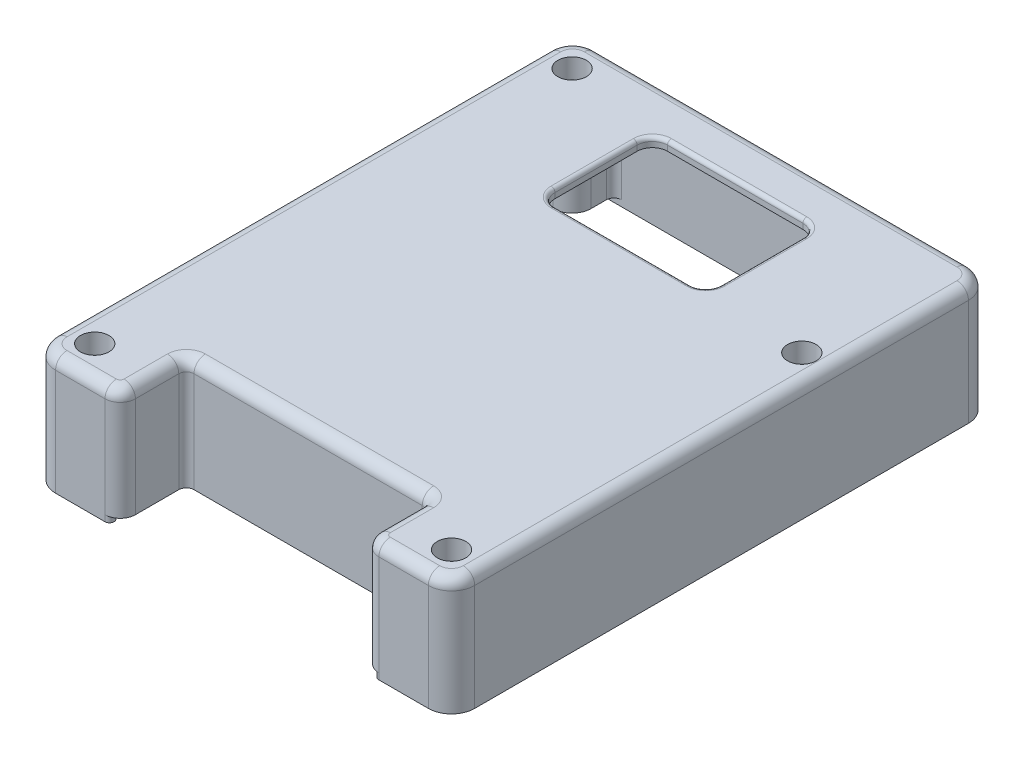
from build123d import *

# Parameters (mm, degrees)
ESQUISSE1_R             = 1.1
BOSS_EXTRU_1_DEPTH      = 13.5
BOSS_EXTRU_2_DEPTH      = 1.2
CONG_1_R                = 1.5
BOSS_EXTRU_3_START      = 0.8
BOSS_EXTRU_3_DEPTH      = 0.8
ESQUISSE4_W             = 37.676641801
ESQUISSE4_H             = 10.486455041
ENL_V_MAT_EXTRU_1_DEPTH = 0.8
CONG_2_R                = 0.6
ESQUISSE5_R             = 1.25
ENL_V_MAT_EXTRU_2_DEPTH = 48.156574303
ESQUISSE6_R             = 1.875
ENL_V_MAT_EXTRU_3_DEPTH = 3.3
CONG_3_R                = 0.6
CONG_4_R                = 0.7
ENL_V_MAT_EXTRU_4_DEPTH = 10
CONG_5_R                = 0.5


with BuildPart() as part:
    # Esquisse1 → Boss.-Extru.1 (new body)
    with BuildSketch(Plane(origin=(0, 0, 0), x_dir=(1, 0, 0), z_dir=(0, 1, 0))):
        with BuildLine():
            Line((-24.5, 35.5), (24.5, 35.5))
            ThreePointArc((24.5, 35.5), (26.656675683, 34.606675683), (27.55, 32.45))
            Line((27.55, 32.45), (27.55, -32.45))
            ThreePointArc((27.55, -32.45), (26.656675683, -34.606675683), (24.5, -35.5))
            Line((24.5, -35.5), (18, -35.5))
            ThreePointArc((18, -35.5), (16.585786438, -34.914213562), (16, -33.5))
            Line((16, -33.5), (16, -27.8))
            ThreePointArc((16, -27.8), (15.707106781, -27.092893219), (15, -26.8))
            Line((15, -26.8), (0, -26.8))
            Line((0, -26.8), (-15, -26.8))
            ThreePointArc((-15, -26.8), (-15.707106781, -27.092893219), (-16, -27.8))
            Line((-16, -27.8), (-16, -33.5))
            ThreePointArc((-16, -33.5), (-16.585786438, -34.914213562), (-18, -35.5))
            Line((-18, -35.5), (-24.5, -35.5))
            ThreePointArc((-24.5, -35.5), (-26.656675683, -34.606675683), (-27.55, -32.45))
            Line((-27.55, -32.45), (-27.55, 32.45))
            ThreePointArc((-27.55, 32.45), (-26.656675683, 34.606675683), (-24.5, 35.5))
        make_face()
        with Locations(Location((-23.45, -31.4, 0), (0, 0, 270))):
            Circle(ESQUISSE1_R, mode=Mode.SUBTRACT)
        with Locations(Location((23.45, -31.4, 0), (0, 0, 270))):
            Circle(ESQUISSE1_R, mode=Mode.SUBTRACT)
        with Locations(Location((-23.4, 31.3, 0), (0, 0, 270))):
            Circle(ESQUISSE1_R, mode=Mode.SUBTRACT)
        with Locations(Location((24.05, 14.05, 0), (0, 0, 270))):
            Circle(ESQUISSE1_R, mode=Mode.SUBTRACT)
        with BuildLine():
            Line((-20.9, 31.3), (-20.9, 33.3))
            ThreePointArc((-20.9, 33.3), (-20.607106781, 34.007106781), (-19.9, 34.3))
            Line((-19.9, 34.3), (23.35, 34.3))
            ThreePointArc((23.35, 34.3), (25.471320344, 33.421320344), (26.35, 31.3))
            Line((26.35, 31.3), (26.35, 17.55))
            ThreePointArc((26.35, 17.55), (26.057106781, 16.842893219), (25.35, 16.55))
            Line((25.35, 16.55), (24.05, 16.55))
            ThreePointArc((24.05, 16.55), (21.55, 14.05), (24.05, 11.55))
            Line((24.05, 11.55), (25.35, 11.55))
            ThreePointArc((25.35, 11.55), (26.057106781, 11.257106781), (26.35, 10.55))
            Line((26.35, 10.55), (26.35, -27.9))
            ThreePointArc((26.35, -27.9), (26.057106781, -28.607106781), (25.35, -28.9))
            Line((25.35, -28.9), (23.45, -28.9))
            ThreePointArc((23.45, -28.9), (21.682233047, -29.632233047), (20.95, -31.4))
            Line((20.95, -31.4), (20.95, -33.3))
            ThreePointArc((20.95, -33.3), (20.657106781, -34.007106781), (19.95, -34.3))
            Line((19.95, -34.3), (18.2, -34.3))
            ThreePointArc((18.2, -34.3), (17.492893219, -34.007106781), (17.2, -33.3))
            Line((17.2, -33.3), (17.2, -26.6))
            ThreePointArc((17.2, -26.6), (16.907106781, -25.892893219), (16.2, -25.6))
            Line((16.2, -25.6), (-16.2, -25.6))
            ThreePointArc((-16.2, -25.6), (-16.907106781, -25.892893219), (-17.2, -26.6))
            Line((-17.2, -26.6), (-17.2, -33.3))
            ThreePointArc((-17.2, -33.3), (-17.492893219, -34.007106781), (-18.2, -34.3))
            Line((-18.2, -34.3), (-19.95, -34.3))
            ThreePointArc((-19.95, -34.3), (-20.657106781, -34.007106781), (-20.95, -33.3))
            Line((-20.95, -33.3), (-20.95, -31.4))
            ThreePointArc((-20.95, -31.4), (-21.682233047, -29.632233047), (-23.45, -28.9))
            Line((-23.45, -28.9), (-25.35, -28.9))
            ThreePointArc((-25.35, -28.9), (-26.057106781, -28.607106781), (-26.35, -27.9))
            Line((-26.35, -27.9), (-26.35, 27.8))
            ThreePointArc((-26.35, 27.8), (-26.057106781, 28.507106781), (-25.35, 28.8))
            Line((-25.35, 28.8), (-23.4, 28.8))
            ThreePointArc((-23.4, 28.8), (-21.632233047, 29.532233047), (-20.9, 31.3))
        make_face(mode=Mode.SUBTRACT)
    extrude(amount=BOSS_EXTRU_1_DEPTH)

    # Esquisse2 → Boss.-Extru.2 (add)
    with BuildSketch(Plane(origin=(0, 13.5, 0), x_dir=(1, 0, 0), z_dir=(0, 1, 0))):
        with BuildLine():
            Line((-24.5, -35.5), (-18, -35.5))
            ThreePointArc((-18, -35.5), (-16.585786438, -34.914213562), (-16, -33.5))
            Line((-16, -33.5), (-16, -27.8))
            ThreePointArc((-16, -27.8), (-15.707106781, -27.092893219), (-15, -26.8))
            Line((-15, -26.8), (15, -26.8))
            ThreePointArc((15, -26.8), (15.707106781, -27.092893219), (16, -27.8))
            Line((16, -27.8), (16, -33.5))
            ThreePointArc((16, -33.5), (16.585786438, -34.914213562), (18, -35.5))
            Line((18, -35.5), (24.5, -35.5))
            ThreePointArc((24.5, -35.5), (26.656675683, -34.606675683), (27.55, -32.45))
            Line((27.55, -32.45), (27.55, 32.45))
            ThreePointArc((27.55, 32.45), (26.656675683, 34.606675683), (24.5, 35.5))
            Line((24.5, 35.5), (-24.5, 35.5))
            ThreePointArc((-24.5, 35.5), (-26.656675683, 34.606675683), (-27.55, 32.45))
            Line((-27.55, 32.45), (-27.55, -32.45))
            ThreePointArc((-27.55, -32.45), (-26.656675683, -34.606675683), (-24.5, -35.5))
        make_face()
    extrude(amount=BOSS_EXTRU_2_DEPTH)

    # Congé1
    cong_1_edges = [part.edges().sort_by_distance(p)[0] for p in [
        (-26.656675683, 14.7, 34.606675683),
        (-21.25, 14.7, 35.5),
        (-16.585786438, 14.7, 34.914213562),
        (-16, 14.7, 30.65),
        (-15.707106781, 14.7, 27.092893219),
        (0, 14.7, 26.8),
        (15.707106781, 14.7, 27.092893219),
        (16, 14.7, 30.65),
        (16.585786438, 14.7, 34.914213562),
        (21.25, 14.7, 35.5),
        (26.656675683, 14.7, 34.606675683),
        (27.55, 14.7, 0),
        (26.656675683, 14.7, -34.606675683),
        (0, 14.7, -35.5),
        (-26.656675683, 14.7, -34.606675683),
        (-27.55, 14.7, 0),
    ]]
    fillet(cong_1_edges, radius=CONG_1_R)

    # Esquisse3 → Boss.-Extru.3 (add)
    with BuildSketch(Plane.XZ.offset(BOSS_EXTRU_3_START)):
        with BuildLine():
            Line((-27.55, 32.45), (-27.55, -32.45))
            ThreePointArc((-27.55, -32.45), (-26.656675683, -34.606675683), (-24.5, -35.5))
            Line((-24.5, -35.5), (24.5, -35.5))
            ThreePointArc((24.5, -35.5), (26.656675683, -34.606675683), (27.55, -32.45))
            Line((27.55, -32.45), (27.55, 32.45))
            ThreePointArc((27.55, 32.45), (26.656675683, 34.606675683), (24.5, 35.5))
            Line((24.5, 35.5), (18, 35.5))
            ThreePointArc((18, 35.5), (16.585786438, 34.914213562), (16, 33.5))
            Line((16, 33.5), (16, 27.8))
            ThreePointArc((16, 27.8), (15.707106781, 27.092893219), (15, 26.8))
            Line((15, 26.8), (-15, 26.8))
            ThreePointArc((-15, 26.8), (-15.707106781, 27.092893219), (-16, 27.8))
            Line((-16, 27.8), (-16, 33.5))
            ThreePointArc((-16, 33.5), (-16.585786438, 34.914213562), (-18, 35.5))
            Line((-18, 35.5), (-24.5, 35.5))
            ThreePointArc((-24.5, 35.5), (-26.656675683, 34.606675683), (-27.55, 32.45))
        make_face()
        with BuildLine():
            Line((-26.35, 32.45), (-26.35, -32.45))
            ThreePointArc((-26.35, -32.45), (-25.808147545, -33.758147545), (-24.5, -34.3))
            Line((-24.5, -34.3), (24.5, -34.3))
            ThreePointArc((24.5, -34.3), (25.808147545, -33.758147545), (26.35, -32.45))
            Line((26.35, -32.45), (26.35, 32.45))
            ThreePointArc((26.35, 32.45), (25.808147545, 33.758147545), (24.5, 34.3))
            Line((24.5, 34.3), (18, 34.3))
            ThreePointArc((18, 34.3), (17.434314575, 34.065685425), (17.2, 33.5))
            Line((17.2, 33.5), (17.2, 27.8))
            ThreePointArc((17.2, 27.8), (16.555634919, 26.244365081), (15, 25.6))
            Line((15, 25.6), (-15, 25.6))
            ThreePointArc((-15, 25.6), (-16.555634919, 26.244365081), (-17.2, 27.8))
            Line((-17.2, 27.8), (-17.2, 33.5))
            ThreePointArc((-17.2, 33.5), (-17.434314575, 34.065685425), (-18, 34.3))
            Line((-18, 34.3), (-24.5, 34.3))
            ThreePointArc((-24.5, 34.3), (-25.808147545, 33.758147545), (-26.35, 32.45))
        make_face(mode=Mode.SUBTRACT)
    extrude(amount=-BOSS_EXTRU_3_DEPTH)

    # Esquisse4 → Enlèv. mat.-Extru.1 (cut)
    with BuildSketch(Plane(origin=(0, -0.8, 0), x_dir=(-1, 0, 0), z_dir=(0, -1, 0))):
        with Locations((-0.005196081, -29.05677248)):
            Rectangle(ESQUISSE4_W, ESQUISSE4_H)
    extrude(amount=-ENL_V_MAT_EXTRU_1_DEPTH, mode=Mode.SUBTRACT)

    # Congé2
    # the kernel refuses this fillet: 0.6 mm, written as the material it takes off along each edge
    with BuildSketch(Plane(origin=(16.166969722, 0, 34.3), x_dir=(0.8366593072472588, 0, 0.5477236562323531), z_dir=(0, -1, 0))) as cong_2_piece_1:
        with BuildLine():
            CenterArc((1.86225296, -0.501996447), CONG_2_R, 56.789164482, 179.999849515)
            Line((1.533618766, -1.003992032), (0, 0))
            ThreePointArc((0, 0), (1.095442918, 0.326678508), (2.190885835, 0))
        make_face()
    extrude(amount=6.277214588, mode=Mode.SUBTRACT)
    with BuildSketch(Plane(origin=(-16.166969722, 0, 34.3), x_dir=(-0.8366593087517094, 0, 0.5477236539342736), z_dir=(0, -1, 0))) as cong_2_piece_2:
        with BuildLine():
            CenterArc((1.862252968, 0.501996447), CONG_2_R, 123.210985846, 179.99984983)
            Line((1.533618775, 1.003992032), (0, 0))
            ThreePointArc((0, 0), (1.095442922, -0.326678511), (2.190885844, 0))
        make_face()
    extrude(amount=6.277214611, mode=Mode.SUBTRACT)

    # Esquisse5 → Enlèv. mat.-Extru.2 (cut, through all)
    with BuildSketch(Plane.XZ.offset(-13.5)):
        with Locations(Location((-23.45, 31.4, 0), (0, 0, 270))):
            Circle(ESQUISSE5_R)
        with Locations(Location((23.45, 31.4, 0), (0, 0, 270))):
            Circle(ESQUISSE5_R)
        with Locations(Location((24.05, -14.05, 0), (0, 0, 270))):
            Circle(ESQUISSE5_R)
        with Locations(Location((-23.4, -31.3, 0), (0, 0, 270))):
            Circle(ESQUISSE5_R)
    extrude(amount=-ENL_V_MAT_EXTRU_2_DEPTH, mode=Mode.SUBTRACT)

    # Esquisse6 → Enlèv. mat.-Extru.3 (cut)
    with BuildSketch(Plane(origin=(0, 14.7, 0), x_dir=(1, 0, 0), z_dir=(0, 1, 0))):
        with Locations(Location((-23.4, 31.3, 0), (0, 0, 270))):
            Circle(ESQUISSE6_R)
        with Locations(Location((24.05, 14.05, 0), (0, 0, 270))):
            Circle(ESQUISSE6_R)
        with Locations(Location((23.45, -31.4, 0), (0, 0, 270))):
            Circle(ESQUISSE6_R)
        with Locations(Location((-23.45, -31.4, 0), (0, 0, 270))):
            Circle(ESQUISSE6_R)
    extrude(amount=-ENL_V_MAT_EXTRU_3_DEPTH, mode=Mode.SUBTRACT)

    # Congé3
    cong_3_edges = [part.edges().sort_by_distance(p)[0] for p in [
        (1.725, 13.5, -34.3),
        (-20.607106781, 13.5, -34.007106781),
        (-20.9, 13.5, -32.3),
        (-21.632233047, 13.5, -29.532233047),
        (-24.375, 13.5, -28.8),
        (-26.057106781, 13.5, -28.507106781),
        (-26.35, 13.5, 0.05),
        (-26.057106781, 13.5, 28.607106781),
        (-24.4, 13.5, 28.9),
        (-21.682233047, 13.5, 29.632233047),
        (-20.95, 13.5, 32.35),
        (-20.657106781, 13.5, 34.007106781),
        (-19.075, 13.5, 34.3),
        (-17.492893219, 13.5, 34.007106781),
        (-17.2, 13.5, 29.95),
        (-16.907106781, 13.5, 25.892893219),
        (0, 13.5, 25.6),
        (16.907106781, 13.5, 25.892893219),
        (17.2, 13.5, 29.95),
        (17.492893219, 13.5, 34.007106781),
        (19.075, 13.5, 34.3),
        (20.657106781, 13.5, 34.007106781),
        (20.95, 13.5, 32.35),
        (21.682233047, 13.5, 29.632233047),
        (24.4, 13.5, 28.9),
        (26.057106781, 13.5, 28.607106781),
        (26.35, 13.5, 8.675),
        (26.057106781, 13.5, -11.257106781),
        (24.7, 13.5, -11.55),
        (21.55, 13.5, -14.05),
        (24.7, 13.5, -16.55),
        (26.057106781, 13.5, -16.842893219),
        (26.35, 13.5, -24.425),
        (25.471320344, 13.5, -33.421320344),
    ]]
    fillet(cong_3_edges, radius=CONG_3_R)

    # Congé4
    cong_4_edges = [part.edges().sort_by_distance(p)[0] for p in [
        (-23.4, 11.4, -33.175),
        (24.05, 11.4, -15.925),
        (23.45, 11.4, 29.525),
        (-23.45, 11.4, 29.525),
    ]]
    fillet(cong_4_edges, radius=CONG_4_R)

    # Esquisse7 → Enlèv. mat.-Extru.4 (cut)
    with BuildSketch(Plane.XZ.offset(-13.5)):
        with BuildLine():
            Line((-8.9, -14.55), (8.9, -14.55))
            ThreePointArc((8.9, -14.55), (10.314213562, -15.135786438), (10.9, -16.55))
            Line((10.9, -16.55), (10.9, -27.35))
            ThreePointArc((10.9, -27.35), (10.314213562, -28.764213562), (8.9, -29.35))
            Line((8.9, -29.35), (-8.9, -29.35))
            ThreePointArc((-8.9, -29.35), (-10.314213562, -28.764213562), (-10.9, -27.35))
            Line((-10.9, -27.35), (-10.9, -16.55))
            ThreePointArc((-10.9, -16.55), (-10.314213562, -15.135786438), (-8.9, -14.55))
        make_face()
    extrude(amount=-ENL_V_MAT_EXTRU_4_DEPTH, mode=Mode.SUBTRACT)

    # Congé5
    cong_5_edges = [part.edges().sort_by_distance(p)[0] for p in [
        (0, 14.7, -14.55),
        (-10.314213562, 14.7, -15.135786438),
        (-10.9, 14.7, -21.95),
        (-10.314213562, 14.7, -28.764213562),
        (0, 14.7, -29.35),
        (10.314213562, 14.7, -28.764213562),
        (10.9, 14.7, -21.95),
        (10.314213562, 14.7, -15.135786438),
    ]]
    fillet(cong_5_edges, radius=CONG_5_R)


solid = part.part
